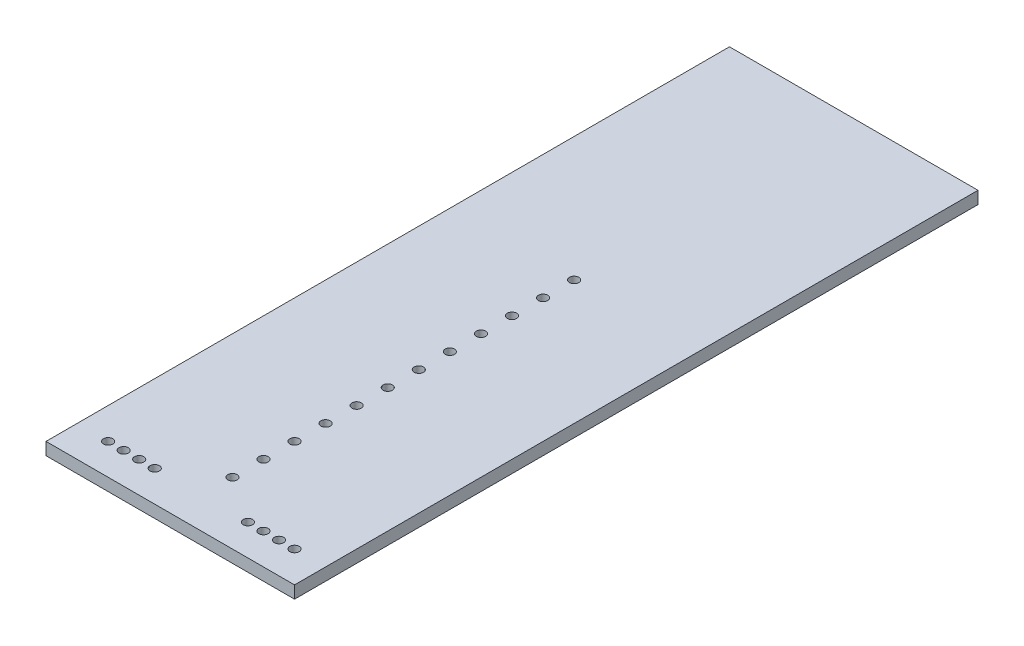
from build123d import *

# Parameters (mm, degrees)
SKETCH2_W         = 80
SKETCH2_H         = 220
MAIN_PLATE_DEPTH  = 4
SKETCH3_R         = 1.5
ELBOW_HOLES_DEPTH = 118.115327776
SKETCH4_R         = 1.5
PIN_HOLES_DEPTH   = 118.115327776


with BuildPart() as part:
    # Sketch2 → main_plate (new body)
    with BuildSketch(Plane(origin=(0, 0, 0), x_dir=(1, 0, 0), z_dir=(0, 1, 0))):
        Rectangle(SKETCH2_W, SKETCH2_H)
    extrude(amount=MAIN_PLATE_DEPTH)

    # Sketch3 → elbow_holes (cut, through all)
    with BuildSketch(Plane(origin=(0, 4, 0), x_dir=(1, 0, 0), z_dir=(0, 1, 0))):
        with Locations((30, -100)):
            Circle(SKETCH3_R)
        with Locations((25, -100)):
            Circle(SKETCH3_R)
        with Locations((20, -100)):
            Circle(SKETCH3_R)
        with Locations((15, -100)):
            Circle(SKETCH3_R)
    elbow_holes = extrude(amount=-ELBOW_HOLES_DEPTH, mode=Mode.SUBTRACT)

    # Sketch4 → pin_holes (cut, through all)
    with BuildSketch(Plane(origin=(0, 4, 0), x_dir=(1, 0, 0), z_dir=(0, 1, 0))):
        with Locations((0, -90)):
            Circle(SKETCH4_R)
        with Locations((0, -80)):
            Circle(SKETCH4_R)
        with Locations((0, -70)):
            Circle(SKETCH4_R)
        with Locations((0, -60)):
            Circle(SKETCH4_R)
        with Locations((0, -50)):
            Circle(SKETCH4_R)
        with Locations((0, -40)):
            Circle(SKETCH4_R)
        with Locations((0, -30)):
            Circle(SKETCH4_R)
        with Locations((0, -20)):
            Circle(SKETCH4_R)
        with Locations((0, -10)):
            Circle(SKETCH4_R)
        Circle(SKETCH4_R)
        with Locations((0, 10)):
            Circle(SKETCH4_R)
        with Locations((0, 20)):
            Circle(SKETCH4_R)
    extrude(amount=-PIN_HOLES_DEPTH, mode=Mode.SUBTRACT)

    # Mirror1: elbow_holes across plane
    add(elbow_holes.mirror(Plane(origin=(0, 0, 0), x_dir=(0, 0, 1), z_dir=(1, 0, 0))), mode=Mode.SUBTRACT)


solid = part.part
